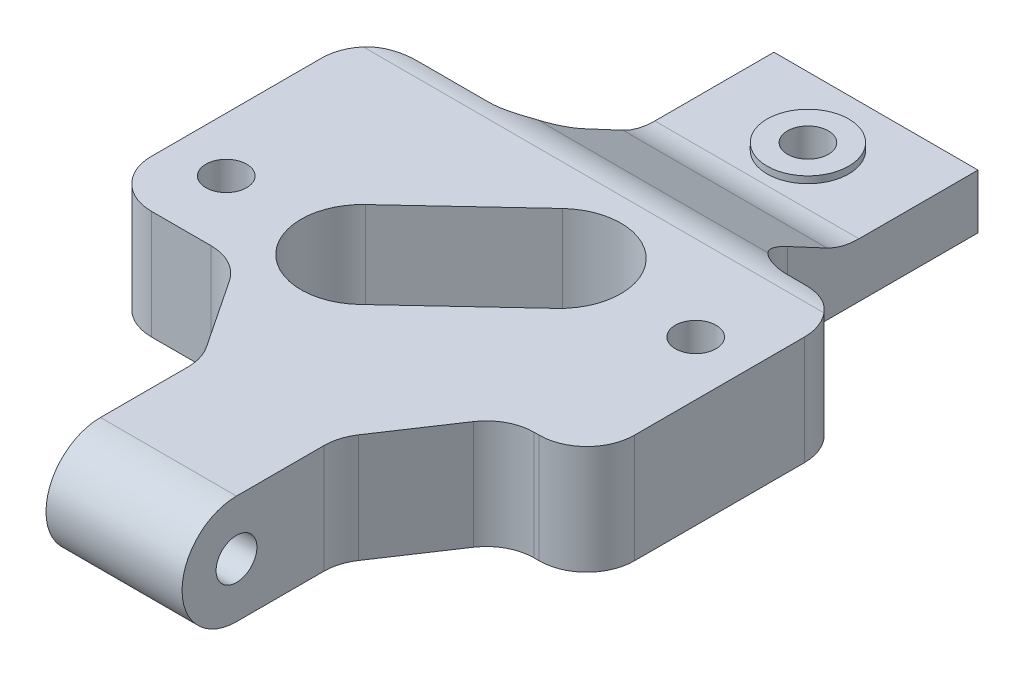
from build123d import *

# Parameters (mm, degrees)
SKETCH_1_R          = 3
EXTRUDE_1_DEPTH     = 16
CUT_EXTRUDE_1_REACH = 84.476
SKETCH_2_R          = 3
CUT_EXTRUDE_2_REACH = 84.476
CUT_EXTRUDE_3_DEPTH = 30
SKETCH_5_R          = 3
CUT_EXTRUDE_4_DEPTH = 78.517739905
EXTRUDE_START       = 1
SKETCH_6_R          = 6
SKETCH_6_R_2        = 3
EXTRUDE_2_DEPTH     = 1
FILLET_1_R          = 7
FILLET_START        = -27
FILLET_3_DEPTH      = 69
FILLET_START_2      = -3.5
FILLET_3_2_DEPTH    = 30


with BuildPart() as part:
    # 草图1 → 凸台-拉伸1 (new body)
    with BuildSketch(Plane(origin=(0, 0, 0), x_dir=(1, 0, 0), z_dir=(0, 1, 0))):
        Polygon((-3.5, 64), (26.5, 64), (26.5, 29), (43, 29), (43, -10), (31.5, -10), (21.5, -25), (21.5, -48), (1.5, -48), (1.5, -25), (-8.5, -10), (-28, -10), (-28, 29), (-3.5, 29), align=None)
        with Locations(Location((-20, 0, 0), (0, 0, 270))):
            Circle(SKETCH_1_R, mode=Mode.SUBTRACT)
        with Locations(Location((35, 14, 0), (0, 0, 270))):
            Circle(SKETCH_1_R, mode=Mode.SUBTRACT)
        with BuildLine():
            Line((6.140864253, -6.579497414), (21.140864253, 7.420502586))
            ThreePointArc((21.140864253, 7.420502586), (21.579497414, 20.140864253), (8.859135747, 20.579497414))
            Line((8.859135747, 20.579497414), (-6.140864253, 6.579497414))
            ThreePointArc((-6.140864253, 6.579497414), (-6.579497414, -6.140864253), (6.140864253, -6.579497414))
        make_face(mode=Mode.SUBTRACT)
    extrude(amount=EXTRUDE_1_DEPTH)

    # 草图2 → 切除-拉伸1 (cut, up to next)
    with BuildSketch(Plane(origin=(21.5, 0, 0), x_dir=(0, 0, -1), z_dir=(1, 0, 0)), mode=Mode.PRIVATE) as cut_extrude_1_sk1:
        with Locations((-40, 8)):
            Circle(SKETCH_2_R)
    cut_extrude_1_tool1 = extrude(cut_extrude_1_sk1.sketch, amount=-CUT_EXTRUDE_1_REACH, mode=Mode.PRIVATE) & part.part
    add(cut_extrude_1_tool1.solids().sort_by_distance((21.5, 8, 40))[0], mode=Mode.SUBTRACT)

    # 草图3 → 切除-拉伸2 (cut, up to next)
    with BuildSketch(Plane(origin=(21.5, 0, 0), x_dir=(0, 0, -1), z_dir=(1, 0, 0)), mode=Mode.PRIVATE) as cut_extrude_2_sk1:
        with BuildLine():
            ThreePointArc((-48, 8), (-45.656854249, 13.656854249), (-40, 16))
            Line((-40, 16), (-48, 16))
            Line((-48, 16), (-48, 8))
        make_face()
    cut_extrude_2_tool1 = extrude(cut_extrude_2_sk1.sketch, amount=-CUT_EXTRUDE_2_REACH, mode=Mode.PRIVATE) & part.part
    # 草图3 → 切除-拉伸2 (cut, up to next)
    with BuildSketch(Plane(origin=(21.5, 0, 0), x_dir=(0, 0, -1), z_dir=(1, 0, 0)), mode=Mode.PRIVATE) as cut_extrude_2_sk2:
        with BuildLine():
            Line((-48, 0), (-40, 0))
            ThreePointArc((-40, 0), (-45.656854249, 2.343145751), (-48, 8))
            Line((-48, 8), (-48, 0))
        make_face()
    cut_extrude_2_tool2 = extrude(cut_extrude_2_sk2.sketch, amount=-CUT_EXTRUDE_2_REACH, mode=Mode.PRIVATE) & part.part
    add(cut_extrude_2_tool1.solids().sort_by_distance((21.5, 14.213056, 46.213056))[0], mode=Mode.SUBTRACT)
    add(cut_extrude_2_tool2.solids().sort_by_distance((21.5, 1.786944, 46.213056))[0], mode=Mode.SUBTRACT)

    # 草图4 → 切除-拉伸3 (cut)
    with BuildSketch(Plane(origin=(26.5, 0, 0), x_dir=(0, 0, -1), z_dir=(1, 0, 0))):
        Polygon((29, 16), (64, 16), (64, 8), (44, 8), align=None)
    extrude(amount=-CUT_EXTRUDE_3_DEPTH, mode=Mode.SUBTRACT)

    # 草图5 → 切除-拉伸4 (cut, through all)
    with BuildSketch(Plane(origin=(0, 8, 0), x_dir=(1, 0, 0), z_dir=(0, 1, 0))):
        with Locations(Location((11.5, 54, 0), (0, 0, 270))):
            Circle(SKETCH_5_R)
    extrude(amount=-CUT_EXTRUDE_4_DEPTH, mode=Mode.SUBTRACT)

    # 草图6 → 凸台-拉伸2 (add)
    with BuildSketch(Plane(origin=(0, 8, 0), x_dir=(1, 0, 0), z_dir=(0, 1, 0)).offset(EXTRUDE_START)):
        with Locations(Location((11.5, 54, 0), (0, 0, 90))):
            Circle(SKETCH_6_R)
        with Locations(Location((11.5, 54, 0), (0, 0, 270))):
            Circle(SKETCH_6_R_2, mode=Mode.SUBTRACT)
    extrude(amount=-EXTRUDE_2_DEPTH)

    # 圆角1
    fillet_1_edges = [part.edges().sort_by_distance(p)[0] for p in [
        (1.5, 8, 25),
        (-8.5, 8, 10),
        (-28, 8, 10),
        (-28, 8, -29),
        (-3.5, 8, -29),
        (26.5, 8, -29),
        (43, 8, -29),
        (43, 8, 10),
        (31.5, 8, 10),
        (21.5, 8, 25),
    ]]
    fillet(fillet_1_edges, radius=FILLET_1_R)

    # 圆角3: read off the stored shape, not the designer's step
    # 圆角3 outline → 圆角3 (cut)
    with BuildSketch(Plane.YZ.offset(FILLET_START)):
        with BuildLine():
            Line((14.823529412, -31.205882353), (16, -29))
            Line((16, -29), (16, -26.5))
            ThreePointArc((16, -26.5), (15.701425001, -28.92535625), (14.823529412, -31.205882353))
        make_face()
    extrude(amount=FILLET_3_DEPTH, mode=Mode.SUBTRACT)

    # Fillet 3 2 outline → Fillet 3 2 (add)
    with BuildSketch(Plane.YZ.offset(FILLET_START_2)):
        with BuildLine():
            Line((8, -44), (8, -46.5))
            ThreePointArc((8, -46.5), (8.298574999, -44.07464375), (9.176470588, -41.794117647))
            Line((9.176470588, -41.794117647), (8, -44))
        make_face()
    extrude(amount=FILLET_3_2_DEPTH)


solid = part.part
